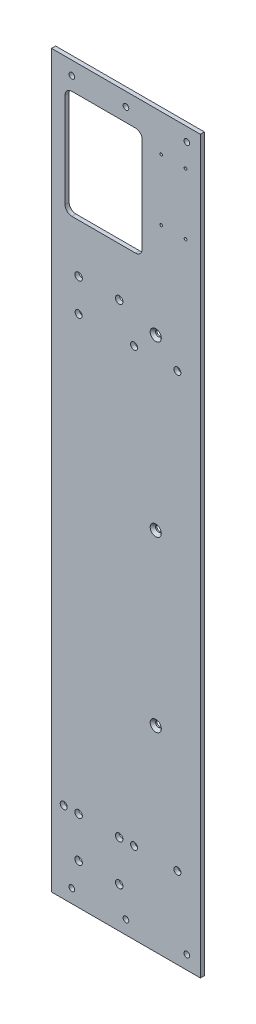
from build123d import *

# Parameters (mm, degrees)
SKETCH_1_W           = 150
SKETCH_1_H           = 540
EXTRUDE_1_DEPTH      = 3
SKETCH_2_R           = 2.1
SKETCH_2_R_2         = 1.6
CUT_EXTRUDE_1_DEPTH  = 281.239183556
CUT_EXTRUDE_2_REACH  = 282.239
SKETCH_4_R           = 2.1
CHAMFER_1_SIZE       = 2
CUT_EXTRUDE_4_REACH  = 282.239
SKETCH_6_R           = 2.6
CUT_EXTRUDE_5_REACH  = 282.239
SKETCH_7_R           = 2.75
CUT_EXTRUDE_6_REACH  = 282.239
SKETCH_8_R           = 2.75
SKETCH_9_R           = 2.75
CUT_EXTRUDE_7_DEPTH  = 10
CUT_EXTRUDE_START    = -10
SKETCH_10_W          = 57
SKETCH_10_H          = 80
SKETCH_10_R          = 1.6
CUT_EXTRUDE_8_DEPTH  = 10
FILLET_1_R           = 5
SKETCH_11_R          = 1
CUT_EXTRUDE_9_DEPTH  = 4
SKETCH_13_W          = 40
SKETCH_13_H          = 540
SKETCH_13_R          = 2.1
SKETCH_13_R_2        = 2.6
CUT_EXTRUDE_10_DEPTH = 10


with BuildPart() as part:
    # 草图1 → 凸台-拉伸1 (new body)
    with BuildSketch(Plane.XY):
        Rectangle(SKETCH_1_W, SKETCH_1_H)
    extrude(amount=EXTRUDE_1_DEPTH)

    # 草图2 → 切除-拉伸1 (cut, through all)
    with BuildSketch(Plane(origin=(0, 0, 0), x_dir=(-1, 0, 0), z_dir=(0, 0, -1))):
        with Locations((65, -260)):
            Circle(SKETCH_2_R)
        with Locations((-65, -260)):
            Circle(SKETCH_2_R)
        with Locations((65, 260)):
            Circle(SKETCH_2_R)
        with Locations((-65, 260)):
            Circle(SKETCH_2_R)
        with Locations((-20, -260)):
            Circle(SKETCH_2_R)
        with Locations((20, -260)):
            Circle(SKETCH_2_R)
        with Locations((20, 260)):
            Circle(SKETCH_2_R)
        with Locations((-20, 260)):
            Circle(SKETCH_2_R)
        with Locations((15, 196.5)):
            Circle(SKETCH_2_R_2)
        with Locations((15, 188.5)):
            Circle(SKETCH_2_R_2)
        with Locations((-15, 196.5)):
            Circle(SKETCH_2_R_2)
        with Locations((-15, 188.5)):
            Circle(SKETCH_2_R_2)
    extrude(amount=-CUT_EXTRUDE_1_DEPTH, mode=Mode.SUBTRACT)

    # 草图4 → 切除-拉伸2 (cut, up to next)
    with BuildSketch(Plane.XY.offset(3), mode=Mode.PRIVATE) as cut_extrude_2_sk1:
        with Locations((42, 125)):
            Circle(SKETCH_4_R)
    cut_extrude_2_tool1 = extrude(cut_extrude_2_sk1.sketch, amount=-CUT_EXTRUDE_2_REACH, mode=Mode.PRIVATE) & part.part
    # 草图4 → 切除-拉伸2 (cut, up to next)
    with BuildSketch(Plane.XY.offset(3), mode=Mode.PRIVATE) as cut_extrude_2_sk2:
        with Locations((42, -125)):
            Circle(SKETCH_4_R)
    cut_extrude_2_tool2 = extrude(cut_extrude_2_sk2.sketch, amount=-CUT_EXTRUDE_2_REACH, mode=Mode.PRIVATE) & part.part
    # 草图4 → 切除-拉伸2 (cut, up to next)
    with BuildSketch(Plane.XY.offset(3), mode=Mode.PRIVATE) as cut_extrude_2_sk3:
        with Locations((42, 0)):
            Circle(SKETCH_4_R)
    cut_extrude_2_tool3 = extrude(cut_extrude_2_sk3.sketch, amount=-CUT_EXTRUDE_2_REACH, mode=Mode.PRIVATE) & part.part
    # 草图4 → 切除-拉伸2 (cut, up to next)
    with BuildSketch(Plane.XY.offset(3), mode=Mode.PRIVATE) as cut_extrude_2_sk4:
        with Locations((-42, 0)):
            Circle(SKETCH_4_R)
    cut_extrude_2_tool4 = extrude(cut_extrude_2_sk4.sketch, amount=-CUT_EXTRUDE_2_REACH, mode=Mode.PRIVATE) & part.part
    # 草图4 → 切除-拉伸2 (cut, up to next)
    with BuildSketch(Plane.XY.offset(3), mode=Mode.PRIVATE) as cut_extrude_2_sk5:
        with Locations((-42, -125)):
            Circle(SKETCH_4_R)
    cut_extrude_2_tool5 = extrude(cut_extrude_2_sk5.sketch, amount=-CUT_EXTRUDE_2_REACH, mode=Mode.PRIVATE) & part.part
    # 草图4 → 切除-拉伸2 (cut, up to next)
    with BuildSketch(Plane.XY.offset(3), mode=Mode.PRIVATE) as cut_extrude_2_sk6:
        with Locations((-42, 125)):
            Circle(SKETCH_4_R)
    cut_extrude_2_tool6 = extrude(cut_extrude_2_sk6.sketch, amount=-CUT_EXTRUDE_2_REACH, mode=Mode.PRIVATE) & part.part
    add(cut_extrude_2_tool1.solids().sort_by_distance((42, 125, 3))[0], mode=Mode.SUBTRACT)
    add(cut_extrude_2_tool2.solids().sort_by_distance((42, -125, 3))[0], mode=Mode.SUBTRACT)
    add(cut_extrude_2_tool3.solids().sort_by_distance((42, 0, 3))[0], mode=Mode.SUBTRACT)
    add(cut_extrude_2_tool4.solids().sort_by_distance((-42, 0, 3))[0], mode=Mode.SUBTRACT)
    add(cut_extrude_2_tool5.solids().sort_by_distance((-42, -125, 3))[0], mode=Mode.SUBTRACT)
    add(cut_extrude_2_tool6.solids().sort_by_distance((-42, 125, 3))[0], mode=Mode.SUBTRACT)

    # 倒角1
    chamfer_1_edges = [part.edges().sort_by_distance(p)[0] for p in [
        (39.9, 0, 3),
        (39.9, -125, 3),
        (39.9, 125, 3),
    ]]
    chamfer(chamfer_1_edges, length=CHAMFER_1_SIZE)

    # 草图6 → 切除-拉伸4 (cut, up to next)
    with BuildSketch(Plane.XY.offset(3), mode=Mode.PRIVATE) as cut_extrude_4_sk1:
        with Locations((26, -210)):
            Circle(SKETCH_6_R)
    cut_extrude_4_tool1 = extrude(cut_extrude_4_sk1.sketch, amount=-CUT_EXTRUDE_4_REACH, mode=Mode.PRIVATE) & part.part
    # 草图6 → 切除-拉伸4 (cut, up to next)
    with BuildSketch(Plane.XY.offset(3), mode=Mode.PRIVATE) as cut_extrude_4_sk2:
        with Locations((-26, -210)):
            Circle(SKETCH_6_R)
    cut_extrude_4_tool2 = extrude(cut_extrude_4_sk2.sketch, amount=-CUT_EXTRUDE_4_REACH, mode=Mode.PRIVATE) & part.part
    # 草图6 → 切除-拉伸4 (cut, up to next)
    with BuildSketch(Plane.XY.offset(3), mode=Mode.PRIVATE) as cut_extrude_4_sk3:
        with Locations((58, -210)):
            Circle(SKETCH_6_R)
    cut_extrude_4_tool3 = extrude(cut_extrude_4_sk3.sketch, amount=-CUT_EXTRUDE_4_REACH, mode=Mode.PRIVATE) & part.part
    # 草图6 → 切除-拉伸4 (cut, up to next)
    with BuildSketch(Plane.XY.offset(3), mode=Mode.PRIVATE) as cut_extrude_4_sk4:
        with Locations((-58, -210)):
            Circle(SKETCH_6_R)
    cut_extrude_4_tool4 = extrude(cut_extrude_4_sk4.sketch, amount=-CUT_EXTRUDE_4_REACH, mode=Mode.PRIVATE) & part.part
    # 草图6 → 切除-拉伸4 (cut, up to next)
    with BuildSketch(Plane.XY.offset(3), mode=Mode.PRIVATE) as cut_extrude_4_sk5:
        with Locations((-47, 110)):
            Circle(SKETCH_6_R)
    cut_extrude_4_tool5 = extrude(cut_extrude_4_sk5.sketch, amount=-CUT_EXTRUDE_4_REACH, mode=Mode.PRIVATE) & part.part
    # 草图6 → 切除-拉伸4 (cut, up to next)
    with BuildSketch(Plane.XY.offset(3), mode=Mode.PRIVATE) as cut_extrude_4_sk6:
        with Locations((-15, 110)):
            Circle(SKETCH_6_R)
    cut_extrude_4_tool6 = extrude(cut_extrude_4_sk6.sketch, amount=-CUT_EXTRUDE_4_REACH, mode=Mode.PRIVATE) & part.part
    # 草图6 → 切除-拉伸4 (cut, up to next)
    with BuildSketch(Plane.XY.offset(3), mode=Mode.PRIVATE) as cut_extrude_4_sk7:
        with Locations((26, 110)):
            Circle(SKETCH_6_R)
    cut_extrude_4_tool7 = extrude(cut_extrude_4_sk7.sketch, amount=-CUT_EXTRUDE_4_REACH, mode=Mode.PRIVATE) & part.part
    # 草图6 → 切除-拉伸4 (cut, up to next)
    with BuildSketch(Plane.XY.offset(3), mode=Mode.PRIVATE) as cut_extrude_4_sk8:
        with Locations((58, 110)):
            Circle(SKETCH_6_R)
    cut_extrude_4_tool8 = extrude(cut_extrude_4_sk8.sketch, amount=-CUT_EXTRUDE_4_REACH, mode=Mode.PRIVATE) & part.part
    add(cut_extrude_4_tool1.solids().sort_by_distance((26, -210, 3))[0], mode=Mode.SUBTRACT)
    add(cut_extrude_4_tool2.solids().sort_by_distance((-26, -210, 3))[0], mode=Mode.SUBTRACT)
    add(cut_extrude_4_tool3.solids().sort_by_distance((58, -210, 3))[0], mode=Mode.SUBTRACT)
    add(cut_extrude_4_tool4.solids().sort_by_distance((-58, -210, 3))[0], mode=Mode.SUBTRACT)
    add(cut_extrude_4_tool5.solids().sort_by_distance((-47, 110, 3))[0], mode=Mode.SUBTRACT)
    add(cut_extrude_4_tool6.solids().sort_by_distance((-15, 110, 3))[0], mode=Mode.SUBTRACT)
    add(cut_extrude_4_tool7.solids().sort_by_distance((26, 110, 3))[0], mode=Mode.SUBTRACT)
    add(cut_extrude_4_tool8.solids().sort_by_distance((58, 110, 3))[0], mode=Mode.SUBTRACT)

    # 草图7 → 切除-拉伸5 (cut, up to next)
    with BuildSketch(Plane.XY.offset(3), mode=Mode.PRIVATE) as cut_extrude_5_sk1:
        with Locations((-15, 134)):
            Circle(SKETCH_7_R)
    cut_extrude_5_tool1 = extrude(cut_extrude_5_sk1.sketch, amount=-CUT_EXTRUDE_5_REACH, mode=Mode.PRIVATE) & part.part
    # 草图7 → 切除-拉伸5 (cut, up to next)
    with BuildSketch(Plane.XY.offset(3), mode=Mode.PRIVATE) as cut_extrude_5_sk2:
        with Locations((15, 134)):
            Circle(SKETCH_7_R)
    cut_extrude_5_tool2 = extrude(cut_extrude_5_sk2.sketch, amount=-CUT_EXTRUDE_5_REACH, mode=Mode.PRIVATE) & part.part
    add(cut_extrude_5_tool1.solids().sort_by_distance((-15, 134, 3))[0], mode=Mode.SUBTRACT)
    add(cut_extrude_5_tool2.solids().sort_by_distance((15, 134, 3))[0], mode=Mode.SUBTRACT)

    # 草图8 → 切除-拉伸6 (cut, up to next)
    with BuildSketch(Plane.XY.offset(3), mode=Mode.PRIVATE) as cut_extrude_6_sk1:
        with Locations((-15, -210)):
            Circle(SKETCH_8_R)
    cut_extrude_6_tool1 = extrude(cut_extrude_6_sk1.sketch, amount=-CUT_EXTRUDE_6_REACH, mode=Mode.PRIVATE) & part.part
    # 草图8 → 切除-拉伸6 (cut, up to next)
    with BuildSketch(Plane.XY.offset(3), mode=Mode.PRIVATE) as cut_extrude_6_sk2:
        with Locations((15, -210)):
            Circle(SKETCH_8_R)
    cut_extrude_6_tool2 = extrude(cut_extrude_6_sk2.sketch, amount=-CUT_EXTRUDE_6_REACH, mode=Mode.PRIVATE) & part.part
    add(cut_extrude_6_tool1.solids().sort_by_distance((-15, -210, 3))[0], mode=Mode.SUBTRACT)
    add(cut_extrude_6_tool2.solids().sort_by_distance((15, -210, 3))[0], mode=Mode.SUBTRACT)

    # 草图9 → 切除-拉伸7 (cut)
    with BuildSketch(Plane.XY.offset(3)):
        with Locations((-15, -240)):
            Circle(SKETCH_9_R)
        with Locations((15, -240)):
            Circle(SKETCH_9_R)
    extrude(amount=-CUT_EXTRUDE_7_DEPTH, mode=Mode.SUBTRACT)

    # 草图10 → 切除-拉伸8 (cut)
    with BuildSketch(Plane.XY.offset(3).offset(CUT_EXTRUDE_START)):
        with Locations((3.5, 210)):
            Rectangle(SKETCH_10_W, SKETCH_10_H)
        with Locations((-15, 188.5)):
            Circle(SKETCH_10_R, mode=Mode.SUBTRACT)
        with Locations((-15, 196.5)):
            Circle(SKETCH_10_R, mode=Mode.SUBTRACT)
        with Locations((15, 196.5)):
            Circle(SKETCH_10_R, mode=Mode.SUBTRACT)
        with Locations((15, 188.5)):
            Circle(SKETCH_10_R, mode=Mode.SUBTRACT)
    extrude(amount=CUT_EXTRUDE_8_DEPTH, mode=Mode.SUBTRACT)

    # 圆角1
    fillet_1_edges = [part.edges().sort_by_distance(p)[0] for p in [
        (-25, 170, 1.5),
        (-25, 250, 1.5),
        (32, 170, 1.5),
        (32, 250, 1.5),
    ]]
    fillet(fillet_1_edges, radius=FILLET_1_R)

    # 草图11 → 切除-拉伸9 (cut)
    with BuildSketch(Plane.XY.offset(3)):
        with Locations((46, 242.6)):
            Circle(SKETCH_11_R)
        with Locations((64, 242.6)):
            Circle(SKETCH_11_R)
        with Locations((64, 197.4)):
            Circle(SKETCH_11_R)
        with Locations((46, 197.4)):
            Circle(SKETCH_11_R)
    extrude(amount=-CUT_EXTRUDE_9_DEPTH, mode=Mode.SUBTRACT)

    # 草图13 → 切除-拉伸10 (cut)
    with BuildSketch(Plane.XY.offset(3)):
        with Locations((-55, 0)):
            Rectangle(SKETCH_13_W, SKETCH_13_H)
        with Locations((-65, -260)):
            Circle(SKETCH_13_R, mode=Mode.SUBTRACT)
        with Locations((-58, -210)):
            Circle(SKETCH_13_R_2, mode=Mode.SUBTRACT)
        with Locations((-47, 110)):
            Circle(SKETCH_13_R_2, mode=Mode.SUBTRACT)
        with Locations((-65, 260)):
            Circle(SKETCH_13_R, mode=Mode.SUBTRACT)
    extrude(amount=-CUT_EXTRUDE_10_DEPTH, mode=Mode.SUBTRACT)


solid = part.part
